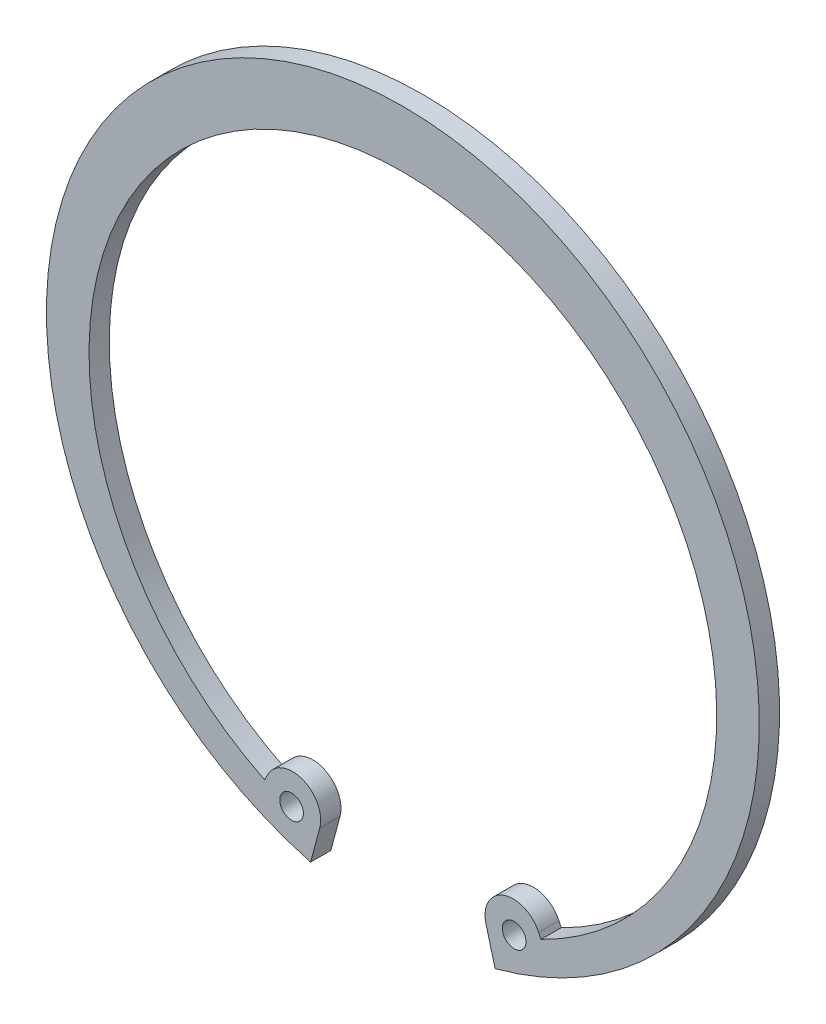
from build123d import *

# Parameters (mm, degrees)
SKETCH2_R           = 1.75
BOSS_EXTRUDE1_DEPTH = 3
FILLET1_R           = 4.16054


with BuildPart() as part:
    # Sketch2 → Boss-Extrude1 (new body)
    with BuildSketch(Plane.XY):
        with BuildLine():
            Line((18.479229397, -39.61885681), (20.435570278, -43.813186973))
            ThreePointArc((20.435570278, -43.813186973), (45.250304059, 8.388683548), (0, 44.35))
            Line((0, 44.35), (0, 52.75))
            ThreePointArc((0, 52.75), (52.298716437, 6.88525664), (13.652704629, -50.952587337))
            Line((13.652704629, -50.952587337), (11.314672737, -42.226933525))
            Line((11.314672737, -42.226933525), (18.479229397, -39.61885681))
        make_face()
        with Locations((16.470452213, -45.245405335)):
            Circle(SKETCH2_R, mode=Mode.SUBTRACT)
    extrude(amount=BOSS_EXTRUDE1_DEPTH)

    # Fillet1
    fillet1_edges = [part.edges().sort_by_distance(p)[0] for p in [
        (18.479229397, -39.61885681, 1.5),
        (11.314672737, -42.226933525, 1.5),
    ]]
    fillet(fillet1_edges, radius=FILLET1_R - 0.0001)  # a hair under: the kernel refuses the full size

    # Mirror1: part across plane


with BuildPart() as part_1:
    add(part.part)
    add(part.part.mirror(Plane(origin=(0, 52.75, 3), x_dir=(0, 0, 1), z_dir=(1, 0, 0))))


solid = part_1.part
